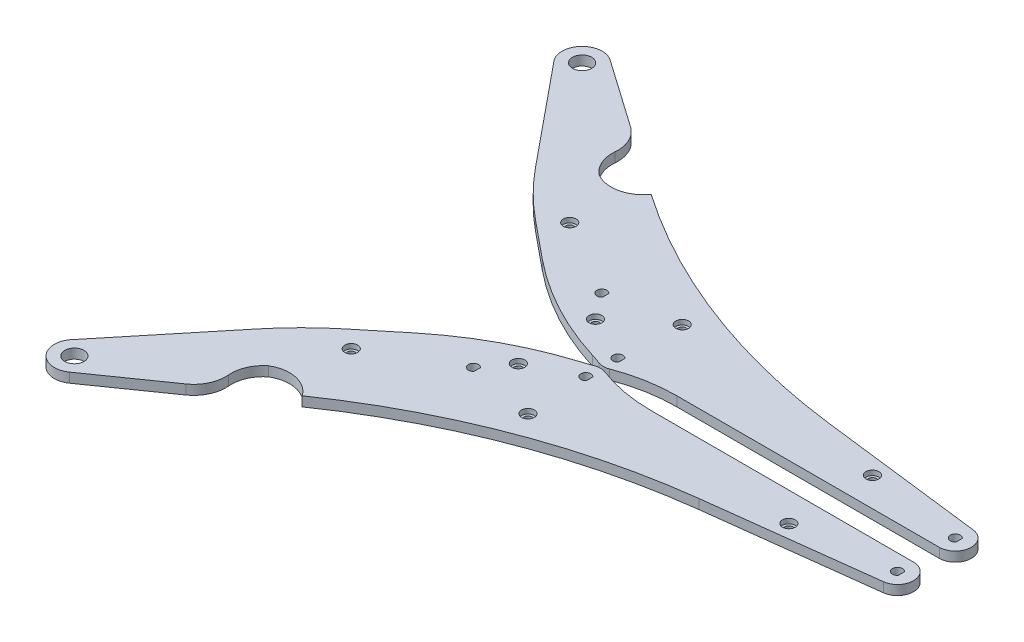
from build123d import *

# Parameters (mm, degrees)
SKETCH_3_R          = 3
EXTRUDE_1_DEPTH     = 3
FILLET_1_R          = 200
FILLET_3_R          = 50
SKETCH_4_R          = 1.25
CUT_EXTRUDE_1_DEPTH = 133.803621182
SKETCH_4_3_R        = 2
SKETCH_4_3_R_2      = 1.25
CUT_EXTRUDE_2_DEPTH = 1.5
FILLET_4_R          = 10
FILLET_5_R          = 10
FILLET_6_R          = 100


# Some blends are built 0.0001 mm under size
with BuildPart() as part:
    # 草图3 → 凸台-拉伸1 (new body)
    with BuildSketch(Plane(origin=(0, 0, 0), x_dir=(1, 0, 0), z_dir=(0, 1, 0))):
        with BuildLine():
            ThreePointArc((3.438749824, 0), (-1, 3.55), (-5.438749824, 0))
            Line((-5.438749824, 0), (-20, 0))
            Line((-20, 0), (-58.823128982, -31.75206117))
            Line((-58.823128982, -31.75206117), (-90.575190152, -70.575190152))
            ThreePointArc((-90.575190152, -70.575190152), (-90.944000004, -79.022324522), (-82.561153427, -80.12594721))
            Line((-82.561153427, -80.12594721), (-53.071679833, -59.477195502))
            Line((-53.071679833, -59.477195502), (-58.807444196, -51.285675059))
            Line((-58.807444196, -51.285675059), (-45.701011487, -42.108452077))
            Line((-45.701011487, -42.108452077), (-39.965247124, -50.29997252))
            Line((-39.965247124, -50.29997252), (0, -22.316005218))
            Line((0, -22.316005218), (100.609346717, -9.962730758))
            ThreePointArc((100.609346717, -9.962730758), (104.990673992, -4.694757302), (100, 0))
            Line((100, 0), (3.438749824, 0))
        make_face()
        with BuildLine():
            Line((0.2, -0.018929156), (0.2, -1.981070844))
            ThreePointArc((0.2, -1.981070844), (-2.55, -1), (0.2, -0.018929156))
        make_face(mode=Mode.SUBTRACT)
        with BuildLine():
            ThreePointArc((-19.8, -16.981070844), (-22.55, -16), (-19.8, -15.018929156))
            Line((-19.8, -15.018929156), (-19.8, -16.981070844))
        make_face(mode=Mode.SUBTRACT)
        with BuildLine():
            ThreePointArc((101.2, -5.981070844), (98.45, -5), (101.2, -4.018929156))
            Line((101.2, -4.018929156), (101.2, -5.981070844))
        make_face(mode=Mode.SUBTRACT)
        with Locations(Location((-86.150380304, -75, 0), (0, 0, 270))):
            Circle(SKETCH_3_R, mode=Mode.SUBTRACT)
    extrude(amount=EXTRUDE_1_DEPTH)

    # 圆角1
    # the kernel refuses this fillet: 200 mm, written as the material it adds along each edge
    with BuildSketch(Plane(origin=(0, 0, 22.316005218), x_dir=(-0.8191520442889868, 0, 0.5735764363510532), z_dir=(0, 1, 0))) as fillet_1_piece_1:
        with BuildLine():
            CenterArc((49.871110762, 199.997070178), FILLET_1_R, 242, 27.689869999)
            Line((-44.023201795, 23.407551606), (-45.901088046, 19.875761235))
            Line((-45.901088046, 19.875761235), (-1.877886251, -3.531790371))
            Line((-1.877886251, -3.531790371), (0, -4))
            ThreePointArc((0, -4), (24.394279061, -4), (48.76690707, -3.999941404))
            Line((48.76690707, -3.999941404), (48.788558122, 0))
        make_face()
    extrude(amount=3)

    # 圆角3
    # the kernel refuses this fillet: 50 mm, written as the material it adds along each edge
    with BuildSketch(Plane(origin=(3.438749824, 0, 0), x_dir=(-0.6554771924780477, 0, -0.7552149694895463), z_dir=(0, 1, 0))) as fillet_3_piece_1:
        with BuildLine():
            CenterArc((27.982022488, -44.040522037), FILLET_3_R, 118.259718548, 20.784438328)
            Line((-9.778725986, -11.266662413), (-10.533940956, -10.611185221))
            Line((-10.533940956, -10.611185221), (-0.755214969, 0.655477192))
            Line((-0.755214969, 0.655477192), (0.473469078, 0.880810441))
            ThreePointArc((0.473469078, 0.880810441), (2.154284303, 0.457687505), (3.835099529, 0.880810441))
            Line((3.835099529, 0.880810441), (4.308568607, 0))
        make_face()
    extrude(amount=3)
    with BuildSketch(Plane(origin=(-5.438749824, 0, 0), x_dir=(-1, 0, 0), z_dir=(0, 1, 0))) as fillet_3_piece_2:
        with BuildLine():
            CenterArc((14.921910743, -49.998699223), FILLET_3_R, 90.413290151, 20.374998027)
            Line((-2.823882627, -3.253787011), (-3.178798495, -2.318888767))
            ThreePointArc((-3.178798495, -2.318888767), (-1.757658507, -1.32685396), (-0.975549412, 0.21978022))
            Line((-0.975549412, 0.21978022), (0, 1))
            ThreePointArc((0, 1), (7.280625088, 1), (14.554036965, 0.999973984))
            Line((14.554036965, 0.999973984), (14.561250176, 0))
        make_face()
    extrude(amount=3)

    # 草图4 → 切除-拉伸1 (cut, through all)
    with BuildSketch(Plane(origin=(0, 3, 0), x_dir=(1, 0, 0), z_dir=(0, 1, 0))):
        with Locations(Location((70.2, -9, 0), (0, 0, 270))):
            Circle(SKETCH_4_R)
        with Locations(Location((0, -20, 0), (0, 0, 270))):
            Circle(SKETCH_4_R)
        with Locations(Location((-45, -30, 0), (0, 0, 270))):
            Circle(SKETCH_4_R)
        with Locations(Location((-15, -8, 0), (0, 0, 270))):
            Circle(SKETCH_4_R)
    extrude(amount=-CUT_EXTRUDE_1_DEPTH, mode=Mode.SUBTRACT)

    # 草图4<3> → 切除-拉伸2 (cut)
    # profile 1 of 4: a face of its own
    with BuildSketch(Plane(origin=(0, 3, 0), x_dir=(1, 0, 0), z_dir=(0, 1, 0))):
        with Locations(Location((70.2, -9, 0), (0, 0, 270))):
            Circle(SKETCH_4_3_R)
        with Locations(Location((70.2, -9, 0), (0, 0, 270))):
            Circle(SKETCH_4_3_R_2, mode=Mode.SUBTRACT)
    # profile 2 of 4: a face of its own
    with BuildSketch(Plane(origin=(0, 3, 0), x_dir=(1, 0, 0), z_dir=(0, 1, 0))):
        with Locations(Location((0, -20, 0), (0, 0, 270))):
            Circle(SKETCH_4_3_R)
        with Locations(Location((0, -20, 0), (0, 0, 270))):
            Circle(SKETCH_4_3_R_2, mode=Mode.SUBTRACT)
    # profile 3 of 4: a face of its own
    with BuildSketch(Plane(origin=(0, 3, 0), x_dir=(1, 0, 0), z_dir=(0, 1, 0))):
        with Locations(Location((-45, -30, 0), (0, 0, 270))):
            Circle(SKETCH_4_3_R)
        with Locations(Location((-45, -30, 0), (0, 0, 270))):
            Circle(SKETCH_4_3_R_2, mode=Mode.SUBTRACT)
    # profile 4 of 4: a face of its own
    with BuildSketch(Plane(origin=(0, 3, 0), x_dir=(1, 0, 0), z_dir=(0, 1, 0))):
        with Locations(Location((-15, -8, 0), (0, 0, 270))):
            Circle(SKETCH_4_3_R)
        with Locations(Location((-15, -8, 0), (0, 0, 270))):
            Circle(SKETCH_4_3_R_2, mode=Mode.SUBTRACT)
    extrude(amount=-CUT_EXTRUDE_2_DEPTH, mode=Mode.SUBTRACT)

    # 圆角4
    fillet_4_edges = [part.edges().sort_by_distance(p)[0] for p in [
        (-53.071679833, 1.5, 59.477195502),
    ]]
    fillet(fillet_4_edges, radius=FILLET_4_R - 0.0001)  # a hair under: the kernel refuses the full size

    # 圆角5
    # the kernel refuses this fillet: 10 mm, written as the material it adds along each edge
    with BuildSketch(Plane(origin=(-45.701011487, 0, 42.108452077), x_dir=(-0.8191520442889864, 0, 0.5735764363510539), z_dir=(0, 1, 0))) as fillet_5_piece_1:
        with BuildLine():
            CenterArc((FILLET_5_R, FILLET_5_R), FILLET_5_R, 180, 90)
            Line((0, FILLET_5_R), (0, 0))
            Line((0, 0), (FILLET_5_R, 0))
        make_face()
    extrude(amount=3)
    with BuildSketch(Plane(origin=(-58.807444196, 0, 51.285675059), x_dir=(0.3420261980761126, 0, 0.9396904170148804), z_dir=(0, 1, 0))) as fillet_5_piece_2:
        with BuildLine():
            CenterArc((7.764622652, 9.659249058), FILLET_5_R, 194.999630824, 60.000165399)
            Line((-1.894652287, 7.071120845), (-2.860579781, 6.812308023))
            Line((-2.860579781, 6.812308023), (-0.965927494, -0.258812821))
            Line((-0.965927494, -0.258812821), (0.258812821, -0.965927494))
            ThreePointArc((0.258812821, -0.965927494), (0.258909414, -0.965901613), (4.917575367, -0.965924906))
            Line((4.917575367, -0.965924906), (5.176397847, 0))
        make_face()
    extrude(amount=3)

    # 圆角6
    fillet_6_edges = [part.edges().sort_by_distance(p)[0] for p in [
        (-58.823128982, 1.5, 31.75206117),
        (-20, 1.5, 0),
    ]]
    fillet(fillet_6_edges, radius=FILLET_6_R)


with BuildPart() as body_2:
    # 镜向2: mirrored copy
    add(part.part.mirror(Plane.XY.offset(-4)))


solid = Compound([part.part, body_2.part])
